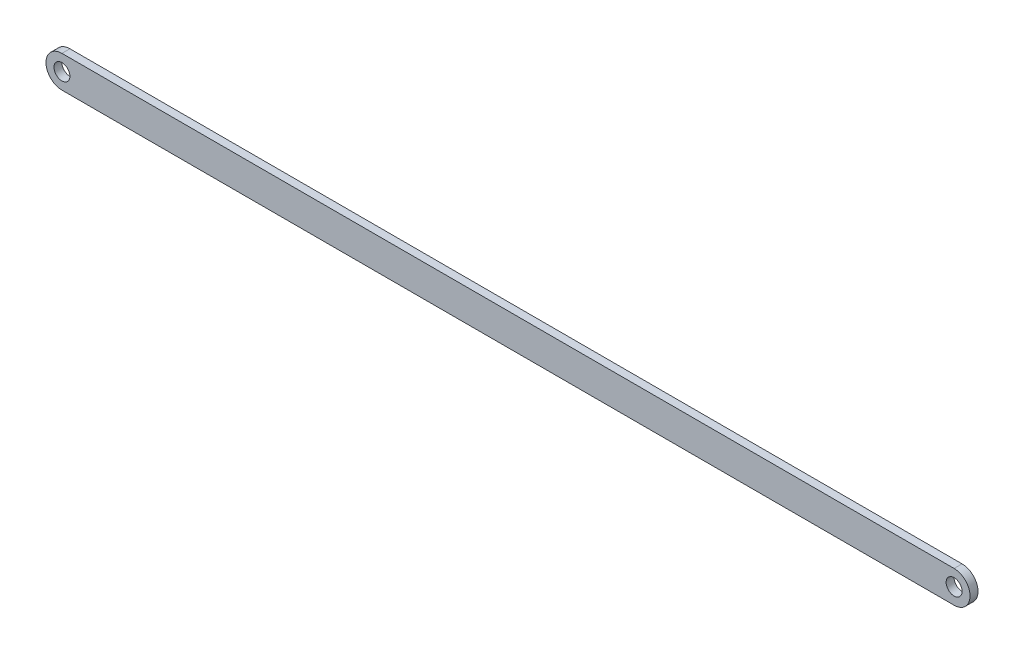
from build123d import *

# Parameters (mm, degrees)
BOSS_EXTRUDE1_DEPTH         = 3.175
F_1_4_0_25_DIAMETER_HOLE2_D = 6.35


with BuildPart() as part:
    # Sketch1 → Boss-Extrude1 (new body)
    with BuildSketch(Plane.XY):
        with BuildLine():
            Line((0, 0), (355.6, 0))
            ThreePointArc((355.6, 0), (361.95, 6.35), (355.6, 12.7))
            Line((355.6, 12.7), (0, 12.7))
            ThreePointArc((0, 12.7), (-6.35, 6.35), (0, 0))
        make_face()
    extrude(amount=BOSS_EXTRUDE1_DEPTH)

    # 1/4 (0.25) Diameter Hole2 (through all)
    with Locations(Plane(origin=(0, 0, 0), x_dir=(-1, 0, 0), z_dir=(0, 0, -1))):
        with Locations((0, 6.35), (-355.6, 6.35)):
            Hole(F_1_4_0_25_DIAMETER_HOLE2_D / 2)


solid = part.part
